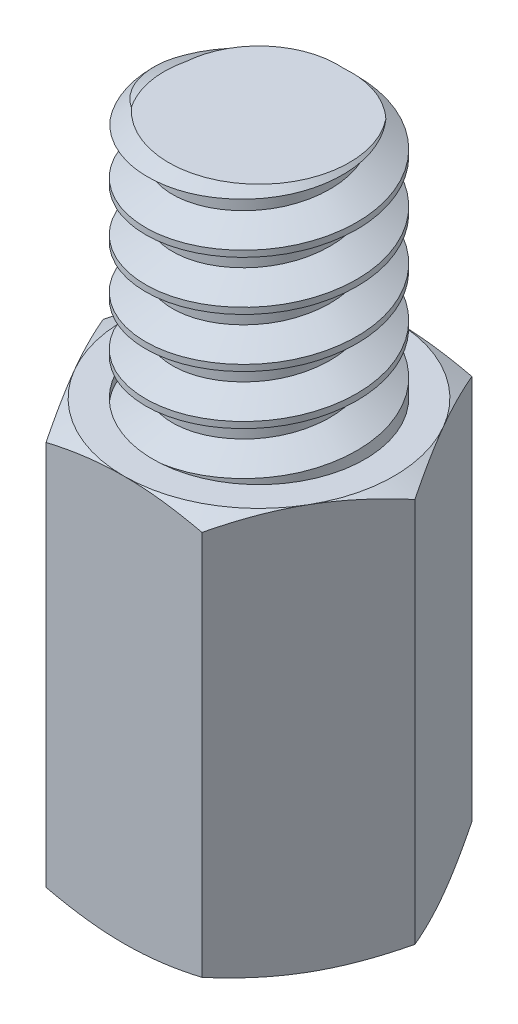
from build123d import *

# Parameters (mm, degrees)
BOSS_EXTRUDE1_DEPTH = 6.5
SKETCH27_OUTSIDE_W  = 9.934
SKETCH27_OUTSIDE_H  = 9.262
SKETCH27_OUTSIDE_R  = 2.167388554
CUT_EXTRUDE16_DEPTH = 0.25
CUT_EXTRUDE16_DRAFT = -65
SKETCH28_OUTSIDE_W  = 9.934
SKETCH28_OUTSIDE_H  = 9.262
SKETCH28_OUTSIDE_R  = 2.167388554
CUT_EXTRUDE17_DEPTH = 0.25
CUT_EXTRUDE17_DRAFT = -65
SKETCH29_R          = 1.50235451
CUT_EXTRUDE18_DEPTH = 4.75
CHAMFER1_SIZE       = 0.25
THREAD1_PITCH       = 0.5
SKETCH34_R          = 1.7
BOSS_EXTRUDE2_DEPTH = 4
CHAMFER2_SIZE       = 0.25
THREAD2_PITCH       = 0.79375


with BuildPart() as part:
    # Sketch23 → Boss-Extrude1 (new body)
    with BuildSketch(Plane(origin=(0, 0, 0), x_dir=(1, 0, 0), z_dir=(0, 1, 0))):
        Polygon((2.50268473, 0), (1.251342365, 2.167388554), (-1.251342365, 2.167388554), (-2.50268473, 0), (-1.251342365, -2.167388554), (1.251342365, -2.167388554), align=None)
    extrude(amount=BOSS_EXTRUDE1_DEPTH)


with BuildPart() as cut_extrude16_tool:
    # Sketch27 outside → Cut-Extrude16 (with draft: the straight prism first)
    with BuildSketch(Plane(origin=(0, 6.5, 0), x_dir=(1, 0, 0), z_dir=(0, 1, 0))):
        Rectangle(SKETCH27_OUTSIDE_W, SKETCH27_OUTSIDE_H)
        Circle(SKETCH27_OUTSIDE_R, mode=Mode.SUBTRACT)
    extrude(amount=-CUT_EXTRUDE16_DEPTH)
    # Cut-Extrude16: the draft: its side faces are tilted about the plane it starts from
    cut_extrude16_sides = [cut_extrude16_tool.faces().sort_by_distance(p)[0] for p in [
        (0, 6.375, 4.631),
        (4.967, 6.375, 0),
        (0, 6.375, -4.631),
        (-4.967, 6.375, 0),
        (-2.167388554, 6.375, 0),
    ]]
    draft(cut_extrude16_sides, Plane(origin=(0, 6.5, 0), x_dir=(1, 0, 0), z_dir=(0, 1, 0)), CUT_EXTRUDE16_DRAFT)


with BuildPart() as part_1:
    add(part.part)

    # Cut-Extrude16: cut by cut_extrude16_tool
    add(cut_extrude16_tool.part, mode=Mode.SUBTRACT)


with BuildPart() as cut_extrude17_tool:
    # Sketch28 outside → Cut-Extrude17 (with draft: the straight prism first)
    with BuildSketch(Plane(origin=(0, 0, 0), x_dir=(-1, 0, 0), z_dir=(0, -1, 0))):
        Rectangle(SKETCH28_OUTSIDE_W, SKETCH28_OUTSIDE_H)
        Circle(SKETCH28_OUTSIDE_R, mode=Mode.SUBTRACT)
    extrude(amount=-CUT_EXTRUDE17_DEPTH)
    # Cut-Extrude17: the draft: its side faces are tilted about the plane it starts from
    cut_extrude17_sides = [cut_extrude17_tool.faces().sort_by_distance(p)[0] for p in [
        (0, 0.125, 4.631),
        (-4.967, 0.125, 0),
        (0, 0.125, -4.631),
        (4.967, 0.125, 0),
        (2.167388554, 0.125, 0),
    ]]
    draft(cut_extrude17_sides, Plane(origin=(0, 0, 0), x_dir=(-1, 0, 0), z_dir=(0, -1, 0)), CUT_EXTRUDE17_DRAFT)


with BuildPart() as part_2:
    add(part_1.part)

    # Cut-Extrude17: cut by cut_extrude17_tool
    add(cut_extrude17_tool.part, mode=Mode.SUBTRACT)

    # Sketch29 → Cut-Extrude18 (cut)
    with BuildSketch(Plane(origin=(0, 0, 0), x_dir=(-1, 0, 0), z_dir=(0, -1, 0))):
        with Locations(Location((0, 0, 0), (0, 0, 90))):
            Circle(SKETCH29_R)
    extrude(amount=-CUT_EXTRUDE18_DEPTH, mode=Mode.SUBTRACT)

    # Chamfer1
    chamfer1_edges = [part_2.edges().sort_by_distance(p)[0] for p in [
        (0, 0, 1.50235451),
    ]]
    chamfer(chamfer1_edges, length=CHAMFER1_SIZE)

    # Thread1: the profile of Thread Profile1 profile screwed along a right-hand helix of 12 turns, 6 arcs to a turn; built about Z, then put on its axis
    thread1_z = Axis((0, 0, 0), (0, 0, 1))
    thread1_corners = [(1.50205451, 0, -0.000173205), (1.772987447, 0, 0.156249999), (1.772987447, 0, 0.218749999), (1.50205451, 0, 0.375173204)]
    with BuildLine(mode=Mode.PRIVATE) as thread1_profile:
        Line(thread1_corners[0], thread1_corners[1])
        Line(thread1_corners[1], thread1_corners[2])
        Line(thread1_corners[2], thread1_corners[3])
        Line(thread1_corners[3], thread1_corners[0])
    thread1_cap = Face(thread1_profile.wire())
    thread1_turn_angles = [0, 30, 60, 90, 120, 150, 180, 210, 240, 270, 300, 330, 360]
    thread1_turn_weights = [1, 0.8660254037844387, 1, 0.8660254037844387, 1, 0.8660254037844387, 1, 0.8660254037844387, 1, 0.8660254037844387, 1, 0.8660254037844387, 1]
    thread1_turn_rails = [Edge.make_bspline([Vector(p[0], p[1], 0).rotate(thread1_z, thread1_turn_angles[k]) / thread1_turn_weights[k] + Vector(0, 0, p[2] + THREAD1_PITCH * thread1_turn_angles[k] / 360) for k in range(13)], [0, 0, 0, 1, 1, 2, 2, 3, 3, 4, 4, 5, 5, 6, 6, 6], 2, thread1_turn_weights) for p in thread1_corners]
    thread1_turn_sides = [Face.make_surface_from_curves(thread1_turn_rails[p[0]], thread1_turn_rails[p[1]]) for p in [(0, 1), (1, 2), (2, 3), (3, 0)]]
    thread1 = Plane(origin=(0, -1.25, 0), x_dir=(1, 0, 0), z_dir=(0, 1, 0)) * Solid(Shell([*[p.moved(Location((0, 0, THREAD1_PITCH * i))) for i in range(12) for p in thread1_turn_sides], thread1_cap, thread1_cap.rotate(thread1_z, 4320).moved(Location((0, 0, THREAD1_PITCH * 4320 / 360)))]))
    add(thread1, mode=Mode.SUBTRACT)

    # Sketch34 → Boss-Extrude2 (add)
    with BuildSketch(Plane(origin=(0, 6.5, 0), x_dir=(1, 0, 0), z_dir=(0, 1, 0))):
        with Locations(Location((0, 0, 0), (0, 0, 270))):
            Circle(SKETCH34_R)
    extrude(amount=BOSS_EXTRUDE2_DEPTH)

    # Chamfer2
    chamfer2_edges = [part_2.edges().sort_by_distance(p)[0] for p in [
        (0, 10.5, -1.7),
    ]]
    chamfer(chamfer2_edges, length=CHAMFER2_SIZE)

    # Thread2: the profile of Thread Profile2 profile screwed along a right-hand helix of 6.299213 turns, 8 arcs to a turn; built about Z, then put on its axis
    thread2_z = Axis((0, 0, 0), (0, 0, 1))
    thread2_corners = [(1.7003, 0, -0.000173205), (1.7003, 0, 0.694704453), (1.270370212, 0, 0.446484374), (1.270370212, 0, 0.248046874)]
    with BuildLine(mode=Mode.PRIVATE) as thread2_profile:
        Line(thread2_corners[0], thread2_corners[1])
        Line(thread2_corners[1], thread2_corners[2])
        Line(thread2_corners[2], thread2_corners[3])
        Line(thread2_corners[3], thread2_corners[0])
    thread2_cap = Face(thread2_profile.wire())
    thread2_turn_angles = [0, 22.5, 45, 67.5, 90, 112.5, 135, 157.5, 180, 202.5, 225, 247.5, 270, 292.5, 315, 337.5, 360]
    thread2_turn_weights = [1, 0.9238795325112867, 1, 0.9238795325112867, 1, 0.9238795325112867, 1, 0.9238795325112867, 1, 0.9238795325112867, 1, 0.9238795325112867, 1, 0.9238795325112867, 1, 0.9238795325112867, 1]
    thread2_turn_rails = [Edge.make_bspline([Vector(p[0], p[1], 0).rotate(thread2_z, thread2_turn_angles[k]) / thread2_turn_weights[k] + Vector(0, 0, p[2] + THREAD2_PITCH * thread2_turn_angles[k] / 360) for k in range(17)], [0, 0, 0, 1, 1, 2, 2, 3, 3, 4, 4, 5, 5, 6, 6, 7, 7, 8, 8, 8], 2, thread2_turn_weights) for p in thread2_corners]
    thread2_turn_sides = [Face.make_surface_from_curves(thread2_turn_rails[p[0]], thread2_turn_rails[p[1]]) for p in [(0, 1), (1, 2), (2, 3), (3, 0)]]
    thread2_last_angles = [2160, 2182.5, 2205, 2227.5, 2250, 2258.858267717, 2267.716535433]
    thread2_last_weights = [1, 0.9238795325112867, 1, 0.9238795325112867, 1, 0.9880722894415293, 1]
    thread2_last_rails = [Edge.make_bspline([Vector(p[0], p[1], 0).rotate(thread2_z, thread2_last_angles[k]) / thread2_last_weights[k] + Vector(0, 0, p[2] + THREAD2_PITCH * thread2_last_angles[k] / 360) for k in range(7)], [0, 0, 0, 1, 1, 2, 2, 3, 3, 3], 2, thread2_last_weights) for p in thread2_corners]
    thread2_last_sides = [Face.make_surface_from_curves(thread2_last_rails[p[0]], thread2_last_rails[p[1]]) for p in [(0, 1), (1, 2), (2, 3), (3, 0)]]
    thread2 = Plane(origin=(0, 11.75, 0), x_dir=(-1, 0, 0), z_dir=(0, -1, 0)) * Solid(Shell([*[p.moved(Location((0, 0, THREAD2_PITCH * i))) for i in range(6) for p in thread2_turn_sides], *thread2_last_sides, thread2_cap, thread2_cap.rotate(thread2_z, 2267.716535433).moved(Location((0, 0, THREAD2_PITCH * 2267.716535433 / 360)))]))
    add(thread2, mode=Mode.SUBTRACT)


solid = part_2.part
